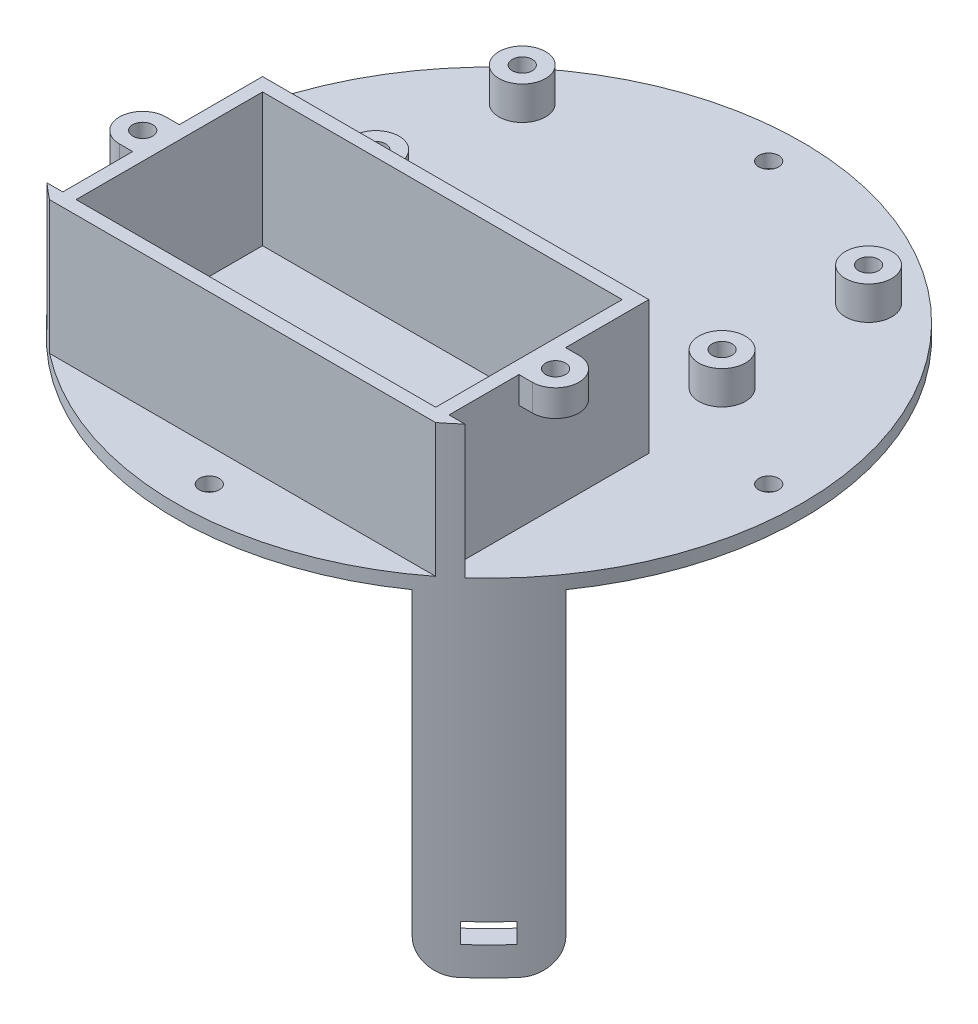
from build123d import *

# Parameters (mm, degrees)
CROQUIS1_R                 = 47
SALIENTE_EXTRUIR1_DEPTH    = 2
CROQUIS2_W                 = 54
CROQUIS2_H                 = 28
SALIENTE_EXTRUIR4_DEPTH    = 20
CROQUIS3_R                 = 3.5
CROQUIS3_R_2               = 1.5
SALIENTE_EXTRUIR5_DEPTH    = 5
CROQUIS4_R                 = 1.5
SALIENTE_EXTRUIR6_DEPTH    = 4
CROQUIS5_R                 = 1.5
CORTAR_EXTRUIR1_DEPTH      = 4
CROQUIS6_R                 = 5
CORTAR_EXTRUIR2_DEPTH      = 4
CROQUIS7_R                 = 2
CORTAR_EXTRUIR3_DEPTH      = 2
SALIENTE_EXTRUIR7_START    = 50
SALIENTE_EXTRUIR7_DEPTH    = 50
REDONDEO1_R                = 5
REDONDEO2_R                = 5
SALIENTE_EXTRUIR9_DEPTH    = 50
CORTAR_EXTRUIR6_DEPTH      = 128.666518168
CORTAR_EXTRUIR6_DEPTH_BACK = 128.666518168
CROQUIS12_W                = 6
CROQUIS12_H                = 3


# Read off the part's stored shape, not the designer's step: Cortar-Extruir7
with BuildPart() as part:
    # Croquis1 → Saliente-Extruir1 (new body)
    with BuildSketch(Plane(origin=(0, 0, 0), x_dir=(1, 0, 0), z_dir=(0, 1, 0))):
        with Locations(Location((0, 0, 0), (0, 0, 270))):
            Circle(CROQUIS1_R)
    extrude(amount=SALIENTE_EXTRUIR1_DEPTH)

    # Croquis2 → Saliente-Extruir4 (add)
    with BuildSketch(Plane(origin=(0, 2, 0), x_dir=(1, 0, 0), z_dir=(0, 1, 0))):
        with BuildLine():
            Line((29, -5), (-29, -5))
            Line((-29, -5), (-29, -35))
            Line((-29, -35), (-31.368774283, -35))
            ThreePointArc((-31.368774283, -35), (-30.19232893, -36.019762267), (-28.982753492, -37))
            Line((-28.982753492, -37), (28.982753492, -37))
            ThreePointArc((28.982753492, -37), (30.19232893, -36.019762267), (31.368774283, -35))
            Line((31.368774283, -35), (29, -35))
            Line((29, -35), (29, -5))
        make_face()
        with Locations((0, -21)):
            Rectangle(CROQUIS2_W, CROQUIS2_H, mode=Mode.SUBTRACT)
    extrude(amount=SALIENTE_EXTRUIR4_DEPTH)

    # Croquis3 → Saliente-Extruir5 (add)
    # profile 1 of 4: a face of its own
    with BuildSketch(Plane(origin=(0, 2, 0), x_dir=(1, 0, 0), z_dir=(0, 1, 0))):
        with Locations(Location((-26, 31, 0), (0, 0, 270))):
            Circle(CROQUIS3_R)
        with Locations(Location((-26, 31, 0), (0, 0, 270))):
            Circle(CROQUIS3_R_2, mode=Mode.SUBTRACT)
    # profile 2 of 4: a face of its own
    with BuildSketch(Plane(origin=(0, 2, 0), x_dir=(1, 0, 0), z_dir=(0, 1, 0))):
        with Locations(Location((-26, 9, 0), (0, 0, 270))):
            Circle(CROQUIS3_R)
        with Locations(Location((-26, 9, 0), (0, 0, 270))):
            Circle(CROQUIS3_R_2, mode=Mode.SUBTRACT)
    # profile 3 of 4: a face of its own
    with BuildSketch(Plane(origin=(0, 2, 0), x_dir=(1, 0, 0), z_dir=(0, 1, 0))):
        with Locations(Location((26, 9, 0), (0, 0, 270))):
            Circle(CROQUIS3_R)
        with Locations(Location((26, 9, 0), (0, 0, 270))):
            Circle(CROQUIS3_R_2, mode=Mode.SUBTRACT)
    # profile 4 of 4: a face of its own
    with BuildSketch(Plane(origin=(0, 2, 0), x_dir=(1, 0, 0), z_dir=(0, 1, 0))):
        with Locations(Location((26, 31, 0), (0, 0, 270))):
            Circle(CROQUIS3_R)
        with Locations(Location((26, 31, 0), (0, 0, 270))):
            Circle(CROQUIS3_R_2, mode=Mode.SUBTRACT)
    extrude(amount=SALIENTE_EXTRUIR5_DEPTH)

    # Croquis4 → Saliente-Extruir6 (add)
    # profile 1 of 2: a face of its own
    with BuildSketch(Plane(origin=(0, 22, 0), x_dir=(1, 0, 0), z_dir=(0, 1, 0))):
        with BuildLine():
            Line((-29, -17.5), (-31, -17.5))
            ThreePointArc((-31, -17.5), (-34.5, -21), (-31, -24.5))
            Line((-31, -24.5), (-29, -24.5))
            Line((-29, -24.5), (-29, -17.5))
        make_face()
        with Locations(Location((-31, -21, 0), (0, 0, 270))):
            Circle(CROQUIS4_R, mode=Mode.SUBTRACT)
    # profile 2 of 2: a face of its own
    with BuildSketch(Plane(origin=(0, 22, 0), x_dir=(1, 0, 0), z_dir=(0, 1, 0))):
        with BuildLine():
            ThreePointArc((31, -24.5), (34.5, -21), (31, -17.5))
            Line((31, -17.5), (29, -17.5))
            Line((29, -17.5), (29, -24.5))
            Line((29, -24.5), (31, -24.5))
        make_face()
        with Locations(Location((31, -21, 0), (0, 0, 270))):
            Circle(CROQUIS4_R, mode=Mode.SUBTRACT)
    extrude(amount=-SALIENTE_EXTRUIR6_DEPTH)

    # Croquis5 → Cortar-Extruir1 (cut)
    with BuildSketch(Plane(origin=(0, 2, 0), x_dir=(1, 0, 0), z_dir=(0, 1, 0))):
        with Locations(Location((0, 42, 0), (0, 0, 270))):
            Circle(CROQUIS5_R)
        with Locations(Location((0, -42, 0), (0, 0, 270))):
            Circle(CROQUIS5_R)
        with Locations(Location((42, 0, 0), (0, 0, 270))):
            Circle(CROQUIS5_R)
        with Locations(Location((-42, 0, 0), (0, 0, 270))):
            Circle(CROQUIS5_R)
    extrude(amount=-CORTAR_EXTRUIR1_DEPTH, mode=Mode.SUBTRACT)

    # Croquis6 → Cortar-Extruir2 (cut)
    with BuildSketch(Plane(origin=(0, 2, 0), x_dir=(1, 0, 0), z_dir=(0, 1, 0))):
        with Locations(Location((0, 0, 0), (0, 0, 270))):
            Circle(CROQUIS6_R)
    extrude(amount=-CORTAR_EXTRUIR2_DEPTH, mode=Mode.SUBTRACT)

    # Croquis7 → Cortar-Extruir3 (cut)
    with BuildSketch(Plane(origin=(0, 0, 5), x_dir=(-1, 0, 0), z_dir=(0, 0, -1))):
        with Locations((-23, 12)):
            Circle(CROQUIS7_R)
    extrude(amount=-CORTAR_EXTRUIR3_DEPTH, mode=Mode.SUBTRACT)

    # Croquis8 → Saliente-Extruir7 (add)
    with BuildSketch(Plane.XZ.offset(SALIENTE_EXTRUIR7_START)):
        with BuildLine():
            Line((-25.237363199, -36.042689949), (-26.958092508, -38.500146082))
            ThreePointArc((-26.958092508, -38.500146082), (-33.234018716, -33.234018716), (-38.500146082, -26.958092508))
            Line((-38.500146082, -26.958092508), (-36.042689949, -25.237363199))
            ThreePointArc((-36.042689949, -25.237363199), (-31.112698372, -31.112698372), (-25.237363199, -36.042689949))
        make_face()
        with BuildLine():
            Line((25.237363199, 36.042689949), (26.958092508, 38.500146082))
            ThreePointArc((26.958092508, 38.500146082), (33.234018716, 33.234018716), (38.500146082, 26.958092508))
            Line((38.500146082, 26.958092508), (36.042689949, 25.237363199))
            ThreePointArc((36.042689949, 25.237363199), (31.112698372, 31.112698372), (25.237363199, 36.042689949))
        make_face()
    extrude(amount=-SALIENTE_EXTRUIR7_DEPTH)

    # Redondeo1
    redondeo1_edges = [part.edges().sort_by_distance(p)[0] for p in [
        (37.271418015, -50, 26.097727854),
        (26.097727854, -50, 37.271418015),
    ]]
    fillet(redondeo1_edges, radius=REDONDEO1_R)

    # Redondeo2
    redondeo2_edges = [part.edges().sort_by_distance(p)[0] for p in [
        (-37.271418015, -50, -26.097727854),
        (-26.097727854, -50, -37.271418015),
    ]]
    fillet(redondeo2_edges, radius=REDONDEO2_R)


with BuildPart() as body_2:
    # Croquis9 → Saliente-Extruir9 (new body)
    with BuildSketch(Plane.XZ.offset(50)):
        Polygon((34.648232278, 34.648232278), (32.526911935, 36.769552622), (33.941125497, 38.183766184), (38.183766184, 33.941125497), (36.769552622, 32.526911935), align=None)
    extrude(amount=-SALIENTE_EXTRUIR9_DEPTH)


with BuildPart() as cortar_extruir6_tool:
    # Croquis12 → Cortar-Extruir6 (new, two sides: drawn at the far end of the back side and taken through both)
    with BuildSketch(Plane(origin=(36.062445841, 0, 36.062445841), x_dir=(0.7071067811865475, 0, -0.7071067811865477), z_dir=(0.7071067811865477, 0, 0.7071067811865475)).offset(-CORTAR_EXTRUIR6_DEPTH_BACK)):
        with Locations((0, -44.2)):
            Rectangle(CROQUIS12_W, CROQUIS12_H)
    extrude(amount=CORTAR_EXTRUIR6_DEPTH + CORTAR_EXTRUIR6_DEPTH_BACK)


with BuildPart() as part_1:
    add(part.part)

    # Cortar-Extruir6: cut by cortar_extruir6_tool
    add(cortar_extruir6_tool.part, mode=Mode.SUBTRACT)


with BuildPart() as body_2_1:
    add(body_2.part)

    # Cortar-Extruir6: cut by cortar_extruir6_tool
    add(cortar_extruir6_tool.part, mode=Mode.SUBTRACT)


solid = part_1.part
